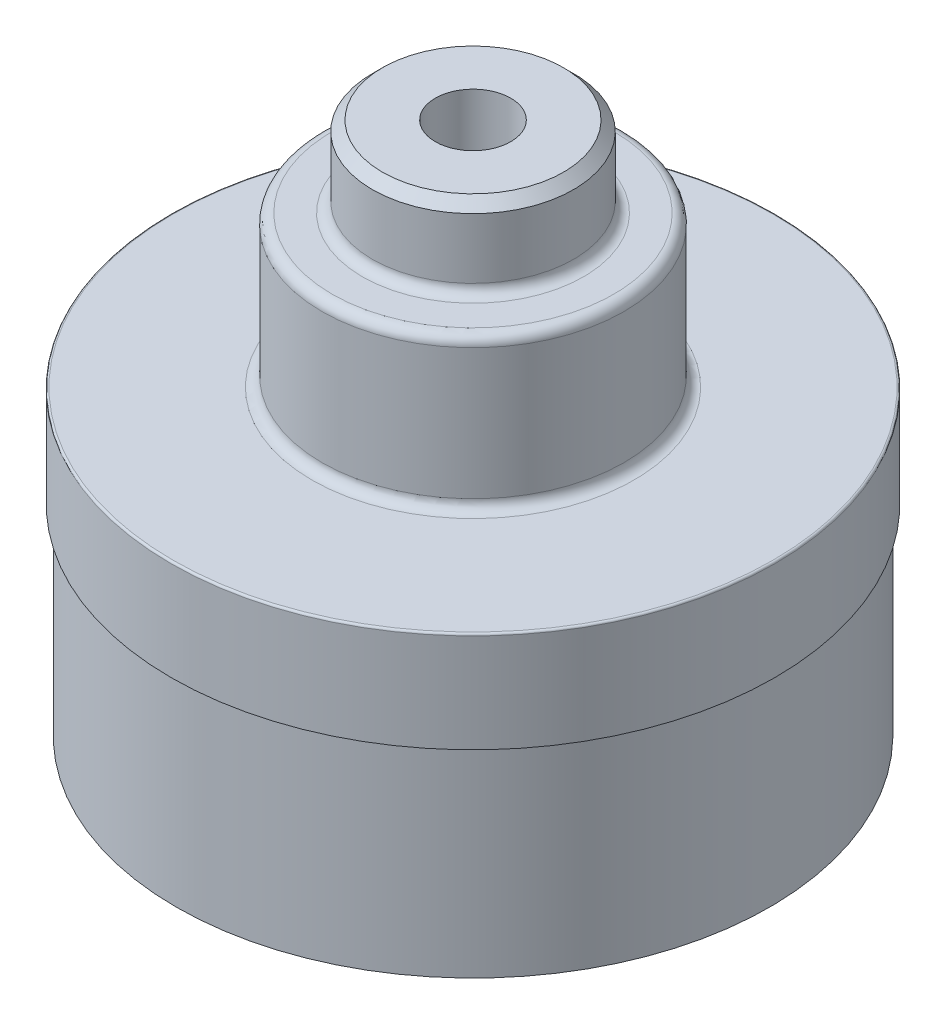
from build123d import *

# Parameters (mm, degrees)
SKETCH1_R                        = 37.465
BOSS_EXTRUDE1_DEPTH              = 25.4
SKETCH2_R                        = 38.1
BOSS_EXTRUDE2_DEPTH              = 12.7
SKETCH3_R                        = 19.05
BOSS_EXTRUDE3_DEPTH              = 19.05
SKETCH4_R                        = 12.7
BOSS_EXTRUDE4_DEPTH              = 10.16
FILLET1_SIZE                     = 1.27
FILLET2_R                        = 1.27
FILLET3_R                        = 0.254
FILLET4_R                        = 1.27
FILLET5_R                        = 1.27
F_3_8_0_375_DIAMETER_HOLE1_D     = 9.525
F_3_8_0_375_DIAMETER_HOLE1_DEPTH = 25.4
F_3_8_0_375_DIAMETER_HOLE1_TIP   = 2.861598698


with BuildPart() as part:
    # Sketch1 → Boss-Extrude1 (new body)
    with BuildSketch(Plane(origin=(0, 0, 0), x_dir=(1, 0, 0), z_dir=(0, 1, 0))):
        Circle(SKETCH1_R)
    extrude(amount=BOSS_EXTRUDE1_DEPTH)

    # Sketch2 → Boss-Extrude2 (add)
    with BuildSketch(Plane(origin=(0, 25.4, 0), x_dir=(1, 0, 0), z_dir=(0, 1, 0))):
        Circle(SKETCH2_R)
    extrude(amount=BOSS_EXTRUDE2_DEPTH)

    # Sketch3 → Boss-Extrude3 (add)
    with BuildSketch(Plane(origin=(0, 38.1, 0), x_dir=(1, 0, 0), z_dir=(0, 1, 0))):
        Circle(SKETCH3_R)
    extrude(amount=BOSS_EXTRUDE3_DEPTH)

    # Sketch4 → Boss-Extrude4 (add)
    with BuildSketch(Plane(origin=(0, 57.15, 0), x_dir=(1, 0, 0), z_dir=(0, 1, 0))):
        Circle(SKETCH4_R)
    extrude(amount=BOSS_EXTRUDE4_DEPTH)

    # Fillet1
    fillet1_edges = [part.edges().sort_by_distance(p)[0] for p in [
        (-12.7, 67.31, 0),
    ]]
    chamfer(fillet1_edges, length=FILLET1_SIZE)

    # Fillet2
    fillet2_edges = [part.edges().sort_by_distance(p)[0] for p in [
        (-19.05, 57.15, 0),
    ]]
    fillet(fillet2_edges, radius=FILLET2_R)

    # Fillet3
    fillet3_edges = [part.edges().sort_by_distance(p)[0] for p in [
        (-38.1, 38.1, 0),
    ]]
    fillet(fillet3_edges, radius=FILLET3_R)

    # Fillet4
    fillet4_edges = [part.edges().sort_by_distance(p)[0] for p in [
        (-19.05, 38.1, 0),
    ]]
    fillet(fillet4_edges, radius=FILLET4_R)

    # Fillet5
    fillet5_edges = [part.edges().sort_by_distance(p)[0] for p in [
        (-12.7, 57.15, 0),
    ]]
    fillet(fillet5_edges, radius=FILLET5_R)

    # 3/8 (0.375) Diameter Hole1
    with Locations(Plane(origin=(0, 67.31, 0), x_dir=(1, 0, 0), z_dir=(0, 1, 0))):
        with Locations((0, 0)):
            Hole(F_3_8_0_375_DIAMETER_HOLE1_D / 2, depth=F_3_8_0_375_DIAMETER_HOLE1_DEPTH)
            with Locations((0, 0, -(F_3_8_0_375_DIAMETER_HOLE1_DEPTH + F_3_8_0_375_DIAMETER_HOLE1_TIP / 2))):  # 118° drill point
                Cone(0, F_3_8_0_375_DIAMETER_HOLE1_D / 2, F_3_8_0_375_DIAMETER_HOLE1_TIP, mode=Mode.SUBTRACT)


solid = part.part
